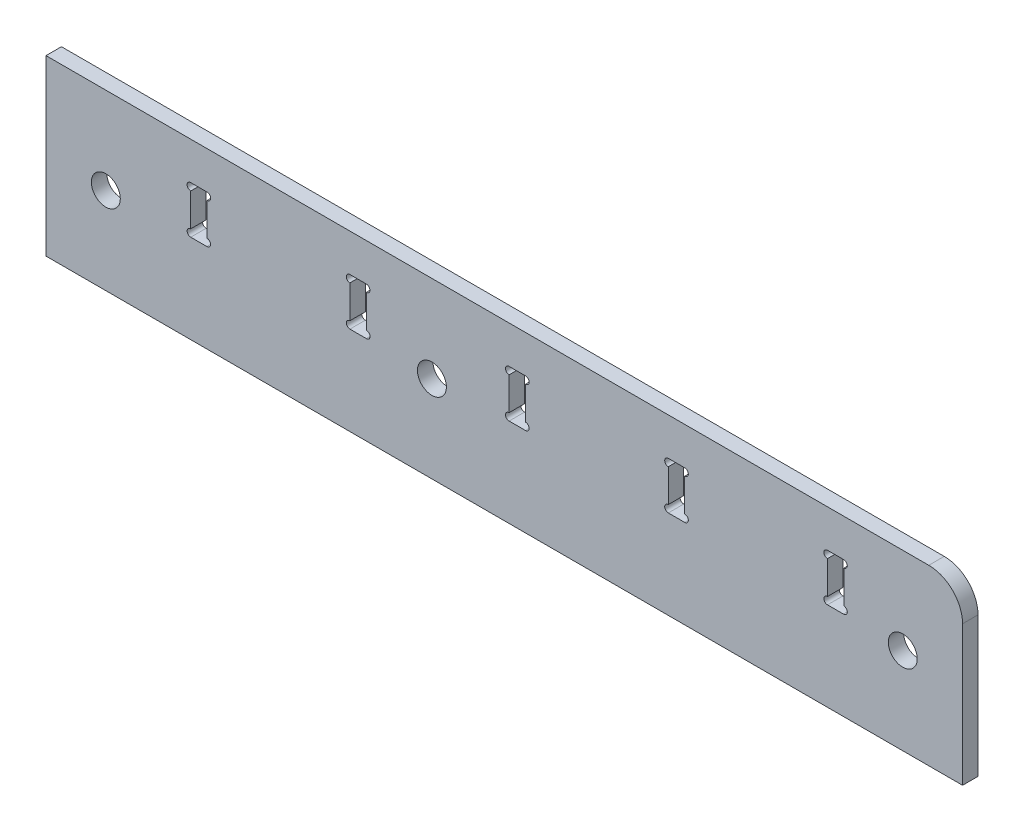
from build123d import *

# Parameters (mm, degrees)
SZKIC1_W                    = 95
SZKIC1_H                    = 18
DODANIE_WYCI_GNI_CIE1_DEPTH = 1.6
GNIAZDO1_START              = -34.197888829
GNIAZDO1_OUTLINE_W          = 4.7
GNIAZDO1_OUTLINE_H          = 1.6
GNIAZDO1_DEPTH              = 1.6
GNIAZDO1_START_2            = -17.697888829
GNIAZDO1_2_OUTLINE_W        = 4.7
GNIAZDO1_2_OUTLINE_H        = 1.6
GNIAZDO1_2_DEPTH            = 1.6
GNIAZDO1_START_3            = -1.197888829
GNIAZDO1_3_OUTLINE_W        = 4.7
GNIAZDO1_3_OUTLINE_H        = 1.6
GNIAZDO1_3_DEPTH            = 1.6
GNIAZDO1_START_4            = 15.302111171
GNIAZDO1_4_OUTLINE_W        = 4.7
GNIAZDO1_4_OUTLINE_H        = 1.6
GNIAZDO1_4_DEPTH            = 1.6
GNIAZDO1_START_5            = 31.802111171
GNIAZDO1_5_OUTLINE_W        = 4.7
GNIAZDO1_5_OUTLINE_H        = 1.6
GNIAZDO1_5_DEPTH            = 1.6
WYTNIJ_WYCI_GNI_CIE2_DEPTH  = 1.6
ZAOKR_GLENIE1_R             = 3.5
SZKIC37_R                   = 1.5
WYTNIJ_WYCI_GNI_CIE3_DEPTH  = 1.6
SZKIC38_R                   = 1.5
WYTNIJ_WYCI_GNI_CIE4_DEPTH  = 60.867696542
SZKIC39_R                   = 0.375000457
SZKIC39_R_2                 = 0.375246396
SZKIC39_R_3                 = 0.375
SZKIC39_R_4                 = 0.375428794
SZKIC39_R_5                 = 0.37501816
SZKIC39_R_6                 = 0.375001619
SZKIC39_R_7                 = 0.375794755
WYTNIJ_WYCI_GNI_CIE5_DEPTH  = 1.6


# Read off the part's stored shape, not the designer's step: Gniazdo1
with BuildPart() as part:
    # Szkic1 → Dodanie-wyciągnięcie1 (new body)
    with BuildSketch(Plane.XY):
        with Locations((-1.797888829, 24.930800849)):
            Rectangle(SZKIC1_W, SZKIC1_H)
    extrude(amount=DODANIE_WYCI_GNI_CIE1_DEPTH)

    # Gniazdo1 outline → Gniazdo1 (cut)
    with BuildSketch(Plane.YZ.offset(GNIAZDO1_START)):
        with Locations((27.580800849, 0.8)):
            Rectangle(GNIAZDO1_OUTLINE_W, GNIAZDO1_OUTLINE_H)
    extrude(amount=GNIAZDO1_DEPTH, mode=Mode.SUBTRACT)

    # Gniazdo1 2 outline → Gniazdo1 2 (cut)
    with BuildSketch(Plane.YZ.offset(GNIAZDO1_START_2)):
        with Locations((27.580800849, 0.8)):
            Rectangle(GNIAZDO1_2_OUTLINE_W, GNIAZDO1_2_OUTLINE_H)
    extrude(amount=GNIAZDO1_2_DEPTH, mode=Mode.SUBTRACT)

    # Gniazdo1 3 outline → Gniazdo1 3 (cut)
    with BuildSketch(Plane.YZ.offset(GNIAZDO1_START_3)):
        with Locations((27.580800849, 0.8)):
            Rectangle(GNIAZDO1_3_OUTLINE_W, GNIAZDO1_3_OUTLINE_H)
    extrude(amount=GNIAZDO1_3_DEPTH, mode=Mode.SUBTRACT)

    # Gniazdo1 4 outline → Gniazdo1 4 (cut)
    with BuildSketch(Plane.YZ.offset(GNIAZDO1_START_4)):
        with Locations((27.580800849, 0.8)):
            Rectangle(GNIAZDO1_4_OUTLINE_W, GNIAZDO1_4_OUTLINE_H)
    extrude(amount=GNIAZDO1_4_DEPTH, mode=Mode.SUBTRACT)

    # Gniazdo1 5 outline → Gniazdo1 5 (cut)
    with BuildSketch(Plane.YZ.offset(GNIAZDO1_START_5)):
        with Locations((27.580800849, 0.8)):
            Rectangle(GNIAZDO1_5_OUTLINE_W, GNIAZDO1_5_OUTLINE_H)
    extrude(amount=GNIAZDO1_5_DEPTH, mode=Mode.SUBTRACT)

    # Szkic35 → Wytnij-wyciągnięcie2 (cut)
    with BuildSketch(Plane.XY.offset(1.6)):
        Polygon((-34.297888829, 30.030800849), (-34.297888829, 25.130800849), (-32.597888829, 25.130800849), (-32.597888829, 30.030800849), (-34.197888829, 30.030800849), align=None)
        Polygon((-17.797888829, 30.030800849), (-17.797888829, 25.130800849), (-16.097888829, 25.130800849), (-16.097888829, 30.030800849), (-17.697888829, 30.030800849), align=None)
        Polygon((-1.297888829, 30.030800849), (-1.297888829, 25.130800849), (0.402111171, 25.130800849), (0.402111171, 30.030800849), (-1.197888829, 30.030800849), align=None)
        Polygon((15.202111171, 30.030800849), (15.202111171, 25.130800849), (16.902111171, 25.130800849), (16.902111171, 30.030800849), (15.302111171, 30.030800849), align=None)
        Polygon((31.702111171, 30.030800849), (31.702111171, 25.130800849), (33.402111171, 25.130800849), (33.402111171, 30.030800849), (31.802111171, 30.030800849), align=None)
    extrude(amount=-WYTNIJ_WYCI_GNI_CIE2_DEPTH, mode=Mode.SUBTRACT)

    # Zaokrąglenie1
    zaokr_glenie1_edges = [part.edges().sort_by_distance(p)[0] for p in [
        (45.702111171, 33.930800849, 0.8),
    ]]
    fillet(zaokr_glenie1_edges, radius=ZAOKR_GLENIE1_R)

    # Szkic37 → Wytnij-wyciągnięcie3 (cut)
    with BuildSketch(Plane.XY.offset(1.6)):
        with Locations((39.502111171, 24.930800849)):
            Circle(SZKIC37_R)
        with Locations((-43.097888829, 24.930800849)):
            Circle(SZKIC37_R)
    extrude(amount=-WYTNIJ_WYCI_GNI_CIE3_DEPTH, mode=Mode.SUBTRACT)

    # Szkic38 → Wytnij-wyciągnięcie4 (cut, through all)
    with BuildSketch(Plane.XY.offset(1.6)):
        with Locations((-9.297888829, 24.930800849)):
            Circle(SZKIC38_R)
    extrude(amount=-WYTNIJ_WYCI_GNI_CIE4_DEPTH, mode=Mode.SUBTRACT)

    # Szkic39 → Wytnij-wyciągnięcie5 (cut)
    with BuildSketch(Plane.XY.offset(1.6)):
        with Locations((-34.298474307, 25.505800849)):
            Circle(SZKIC39_R)
        with Locations((-32.611485055, 25.505800849)):
            Circle(SZKIC39_R_2)
        with Locations((-17.797888829, 25.505800849)):
            Circle(SZKIC39_R_3)
        with Locations((-16.079950616, 25.505800849)):
            Circle(SZKIC39_R_4)
        with Locations((-1.301579386, 25.505800849)):
            Circle(SZKIC39_R_5)
        with Locations((0.402111171, 25.505800849)):
            Circle(SZKIC39_R_3)
        with Locations((15.203212962, 25.505800849)):
            Circle(SZKIC39_R_6)
        with Locations((16.902111171, 25.505800849)):
            Circle(SZKIC39_R_3)
        with Locations((31.702111171, 25.505800849)):
            Circle(SZKIC39_R_3)
        with Locations((33.377683776, 25.505800849)):
            Circle(SZKIC39_R_7)
        with Locations((-34.297888829, 29.655800849)):
            Circle(SZKIC39_R_3)
        with Locations((-32.597888829, 29.655800849)):
            Circle(SZKIC39_R_3)
        with Locations((-17.797888829, 29.655800849)):
            Circle(SZKIC39_R_3)
        with Locations((-16.097888829, 29.655800849)):
            Circle(SZKIC39_R_3)
        with Locations((-1.297888829, 29.655800849)):
            Circle(SZKIC39_R_3)
        with Locations((0.402111171, 29.655800849)):
            Circle(SZKIC39_R_3)
        with Locations((15.203212962, 29.655800849)):
            Circle(SZKIC39_R_6)
        with Locations((16.902111171, 29.655800849)):
            Circle(SZKIC39_R_3)
        with Locations((31.702111171, 29.655800849)):
            Circle(SZKIC39_R_3)
        with Locations((33.377683776, 29.655800849)):
            Circle(SZKIC39_R_7)
    extrude(amount=-WYTNIJ_WYCI_GNI_CIE5_DEPTH, mode=Mode.SUBTRACT)


solid = part.part
